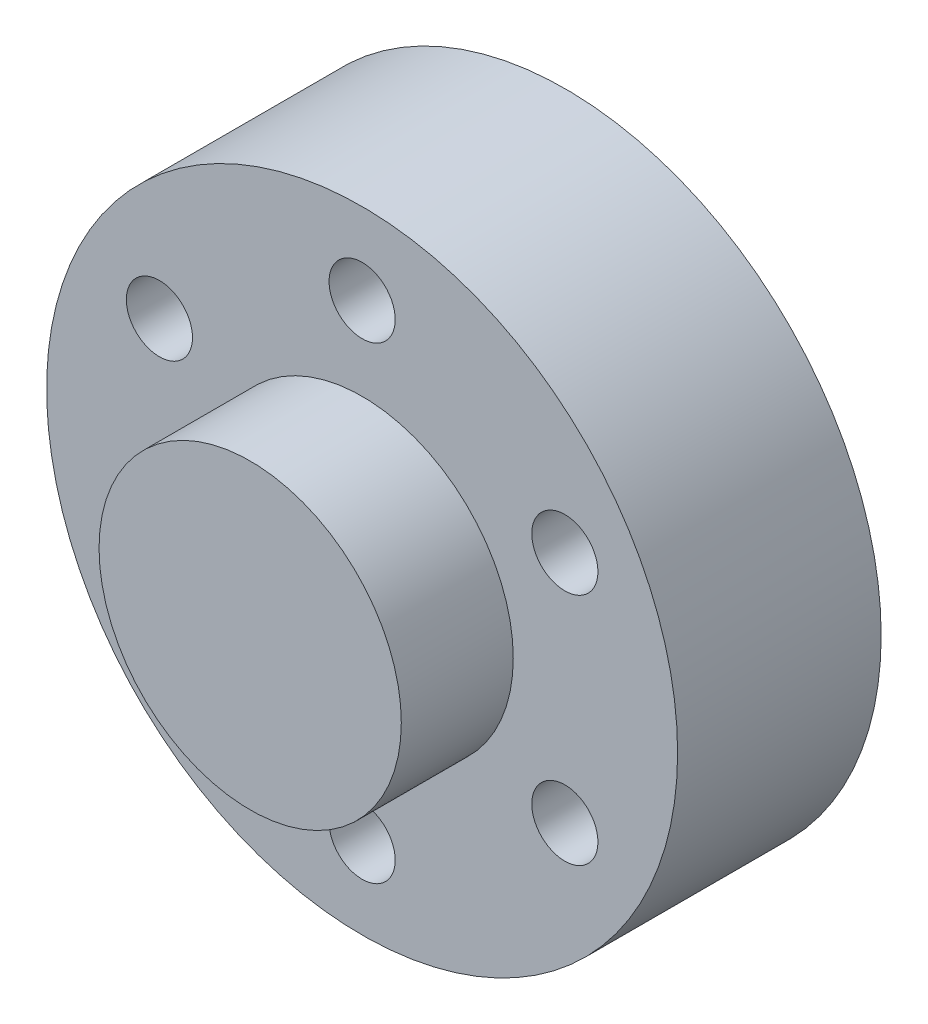
from build123d import *

# Parameters (mm, degrees)
SKETCH2_R           = 15.5
SKETCH2_R_2         = 1.625
BOSS_EXTRUDE1_DEPTH = 10
SKETCH3_R           = 7.425
BOSS_EXTRUDE2_DEPTH = 5.5
BOSS_EXTRUDE4_START = 5.5
SKETCH6_R           = 7.425
BOSS_EXTRUDE4_DEPTH = 5.5
SKETCH7_R           = 2
BOSS_EXTRUDE5_DEPTH = 1
FILLET2_R           = 0.05
CUT_EXTRUDE1_DEPTH  = 11
SKETCH10_R          = 0.8
CUT_EXTRUDE2_DEPTH  = 2.5


with BuildPart() as part:
    # Sketch2 → Boss-Extrude1 (new body)
    with BuildSketch(Plane.XY):
        Circle(SKETCH2_R)
        with Locations((0, -11.5)):
            Circle(SKETCH2_R_2, mode=Mode.SUBTRACT)
        with Locations((-9.959292144, -5.75)):
            Circle(SKETCH2_R_2, mode=Mode.SUBTRACT)
        with Locations((9.959292144, -5.75)):
            Circle(SKETCH2_R_2, mode=Mode.SUBTRACT)
        with Locations((-9.959292144, 5.75)):
            Circle(SKETCH2_R_2, mode=Mode.SUBTRACT)
        with Locations((0, 11.5)):
            Circle(SKETCH2_R_2, mode=Mode.SUBTRACT)
        with Locations((9.959292144, 5.75)):
            Circle(SKETCH2_R_2, mode=Mode.SUBTRACT)
    extrude(amount=BOSS_EXTRUDE1_DEPTH)

    # Sketch3 → Boss-Extrude2 (add)
    with BuildSketch(Plane.XY.offset(10)):
        Circle(SKETCH3_R)
    extrude(amount=BOSS_EXTRUDE2_DEPTH)

    # Sketch6 → Boss-Extrude4 (add)
    with BuildSketch(Plane(origin=(0, 0, 0), x_dir=(-1, 0, 0), z_dir=(0, 0, -1)).offset(BOSS_EXTRUDE4_START)):
        Circle(SKETCH6_R)
    extrude(amount=-BOSS_EXTRUDE4_DEPTH)

    # Sketch7 → Boss-Extrude5 (add)
    with BuildSketch(Plane(origin=(0, 0, -5.5), x_dir=(-1, 0, 0), z_dir=(0, 0, -1))):
        Circle(SKETCH7_R)
    extrude(amount=BOSS_EXTRUDE5_DEPTH)

    # Fillet2
    fillet2_edges = [part.edges().sort_by_distance(p)[0] for p in [
        (2, 0, -6.5),
    ]]
    fillet(fillet2_edges, radius=FILLET2_R)

    # Sketch9 → Cut-Extrude1 (cut)
    with BuildSketch(Plane(origin=(0, 0, -6.5), x_dir=(-1, 0, 0), z_dir=(0, 0, -1))):
        with BuildLine():
            Line((-1.224744871, 1.25), (1.224744871, 1.25))
            ThreePointArc((1.224744871, 1.25), (0, -1.75), (-1.224744871, 1.25))
        make_face()
    extrude(amount=-CUT_EXTRUDE1_DEPTH, mode=Mode.SUBTRACT)

    # Sketch10 → Cut-Extrude2 (cut)
    with BuildSketch(Plane(origin=(0, 0, -5.5), x_dir=(-1, 0, 0), z_dir=(0, 0, -1))):
        with Locations((4.5, 0)):
            Circle(SKETCH10_R)
        with Locations((-4.5, 0)):
            Circle(SKETCH10_R)
    extrude(amount=-CUT_EXTRUDE2_DEPTH, mode=Mode.SUBTRACT)


solid = part.part
